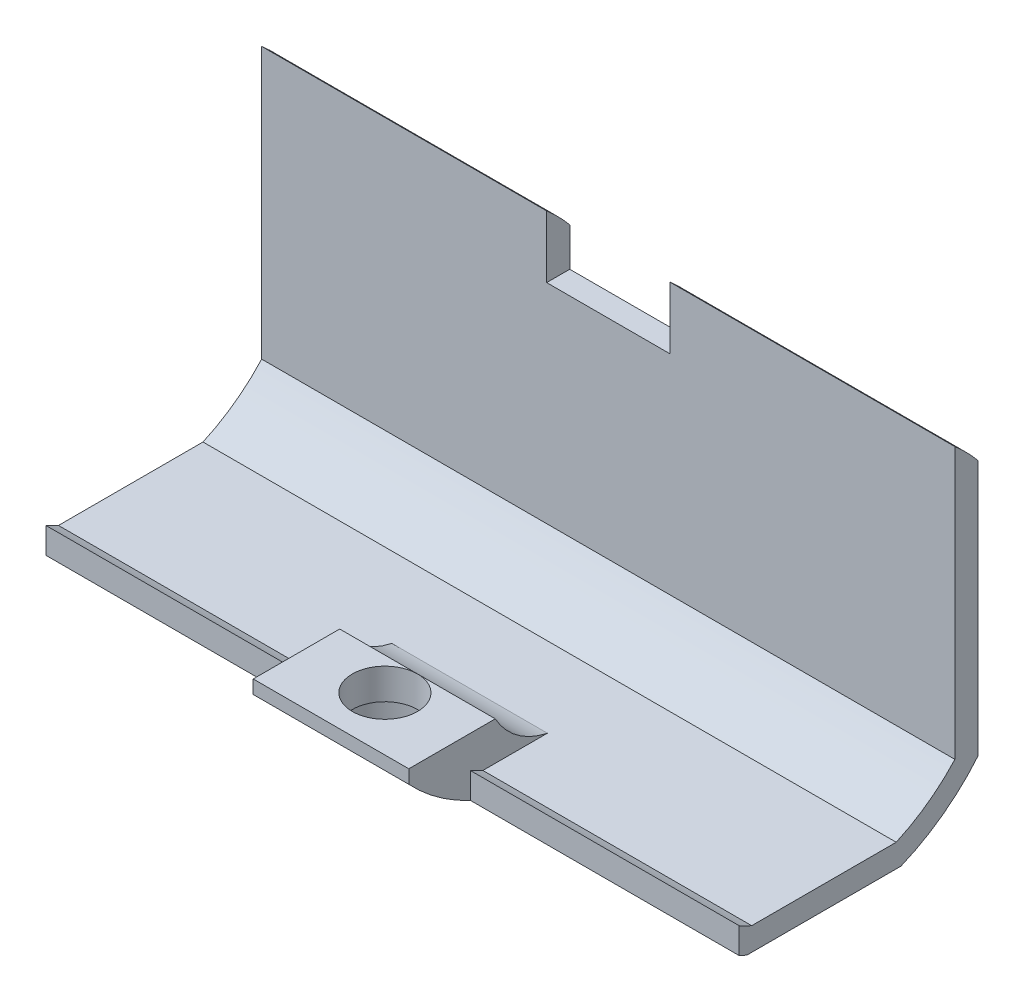
from build123d import *

# Parameters (mm, degrees)
MODEL_R                   = 8.35
RESSALTO_EXTRUS_O2_DEPTH  = 4
ESBO_O5_W                 = 2
ESBO_O5_H                 = 24
RESSALTO_EXTRUS_O3_DEPTH  = 20
ESBO_O6_OUTSIDE_W         = 30.002
ESBO_O6_OUTSIDE_H         = 34.002
ESBO_O6_OUTSIDE_R         = 13
CORTE_EXTRUS_O1_DEPTH     = 72.292987034
CORTE_EXTRUS_O2_DEPTH     = 72.292987124
RESSALTO_EXTRUS_O4_DEPTH  = 4
CORTE_EXTRUS_O3_DEPTH     = 38.486664414
RESSALTO_EXTRUS_O5_START  = 0.5
RESSALTO_EXTRUS_O5_DEPTH  = 45
RESSALTO_EXTRUS_O6_START  = 0.5
ESBO_O14_R                = 2.115
RESSALTO_EXTRUS_O6_DEPTH  = 3.779219
CORTE_EXTRUS_O4_DEPTH     = 10.1
CORTE_EXTRUS_O7_DEPTH     = 10
ESBO_O17_R                = 3.5
CORTE_EXTRUS_O8_DEPTH     = 2
CORTE_EXTRUS_O11_REACH    = 75.217
ESBO_O19_W                = 67.006666236
ESBO_O19_H                = 28.204946311
CORTE_EXTRUS_O9_DEPTH     = 52.948283002
CORPO_MOVER_COPIAR2_ANGLE = 180


with BuildPart() as part:
    # Model → Ressalto-extrusão2 (new body)
    with BuildSketch(Plane.XY):
        Polygon((0, 44.200000002), (0, 59.200000002), (-5.55, 59.200000002), (-5.55, 63.700000002), (-23, 63.700000002), (-23, 39.700000002), (-5.55, 39.700000002), (-5.55, 44.200000002), align=None)
        with Locations((-13.5, 51.700000002)):
            Circle(MODEL_R, mode=Mode.SUBTRACT)
    extrude(amount=RESSALTO_EXTRUS_O2_DEPTH)

    # Esboço5 → Ressalto-extrusão3 (add)
    with BuildSketch(Plane(origin=(0, 0, 0), x_dir=(-1, 0, 0), z_dir=(0, 0, -1))):
        with Locations((24, 51.700000002)):
            Rectangle(ESBO_O5_W, ESBO_O5_H)
    extrude(amount=-RESSALTO_EXTRUS_O3_DEPTH)

    # Esboço6 outside → Corte-extrusão1 (cut, through all)
    with BuildSketch(Plane.ZY.offset(25)):
        with Locations((10, 51.7)):
            Rectangle(ESBO_O6_OUTSIDE_W, ESBO_O6_OUTSIDE_H)
        with Locations((10, 51.700000002)):
            Circle(ESBO_O6_OUTSIDE_R, mode=Mode.SUBTRACT)
    extrude(amount=-CORTE_EXTRUS_O1_DEPTH, mode=Mode.SUBTRACT)

    # Esboço8 → Corte-extrusão2 (cut, through all)
    with BuildSketch(Plane.ZY.offset(25)):
        Polygon((7.885, 51.700000002), (10, 49.585000002), (12.115, 51.700000002), (10, 53.815000002), align=None)
    extrude(amount=-CORTE_EXTRUS_O2_DEPTH, mode=Mode.SUBTRACT)

    # Espelhar1: part across plane


with BuildPart() as part_1:
    add(part.part)
    add(part.part.mirror(Plane(origin=(0, 44.200000002, 4), x_dir=(0, 0, 1), z_dir=(-1, 0, 0))))

    # Esboço9 → Ressalto-extrusão4 (add)
    with BuildSketch(Plane.XY.offset(4)):
        Polygon((0, 59.200000002), (4, 59.200000002), (4, 44.200000002), (-4, 44.200000002), (-4, 59.200000002), align=None)
    extrude(amount=RESSALTO_EXTRUS_O4_DEPTH)

    # Esboço10 → Corte-extrusão3 (cut, through all)
    with BuildSketch(Plane(origin=(0, 59.200000002, 0), x_dir=(1, 0, 0), z_dir=(0, 1, 0))):
        Polygon((0, -1.885), (-2.115, -4), (0, -6.115), (2.115, -4), align=None)
    extrude(amount=-CORTE_EXTRUS_O3_DEPTH, mode=Mode.SUBTRACT)


with BuildPart() as body_2:
    # Esboço13 → Ressalto-extrusão5 (new body)
    with BuildSketch(Plane.ZY.offset(-23).offset(RESSALTO_EXTRUS_O5_START)):
        with BuildLine():
            Line((18.5, 43.95403331), (18.5, 59.445966694))
            ThreePointArc((18.5, 59.445966694), (16.73742843, 61.019713418), (14.69041576, 62.200000002))
            Line((14.69041576, 62.200000002), (5.30958424, 62.200000002))
            ThreePointArc((5.30958424, 62.200000002), (4.900858659, 62.0077038), (4.5, 61.79950494))
            Line((4.5, 61.79950494), (4.5, 63.479218991))
            ThreePointArc((4.5, 63.479218991), (4.748839551, 63.592237552), (5, 63.700000002))
            Line((5, 63.700000002), (15, 63.700000002))
            ThreePointArc((15, 63.700000002), (17.724005232, 62.156564599), (20, 60.006623865))
            Line((20, 60.006623865), (20, 43.393376139))
            ThreePointArc((20, 43.393376139), (19.281560672, 42.597657914), (18.5, 41.863842216))
            Line((18.5, 41.863842216), (18.5, 43.95403331))
        make_face()
    extrude(amount=RESSALTO_EXTRUS_O5_DEPTH)

    # Esboço14 → Ressalto-extrusão6 (add)
    with BuildSketch(Plane(origin=(0, 59.200000002, 0), x_dir=(1, 0, 0), z_dir=(0, 1, 0)).offset(RESSALTO_EXTRUS_O6_START)):
        Polygon((5.05, -4), (5.05, -8), (5.05, -9.5), (-5.05, -9.5), (-5.05, -8), (-5.05, -4), (-5.05, -0.5), (5.05, -0.5), align=None)
        with Locations(Location((0, -4, 0), (0, 0, 346.325447319))):
            Circle(ESBO_O14_R, mode=Mode.SUBTRACT)
    extrude(amount=RESSALTO_EXTRUS_O6_DEPTH)

    # Esboço15 → Corte-extrusão4 (cut)
    with BuildSketch(Plane(origin=(5.05, 0, 0), x_dir=(0, 0, -1), z_dir=(1, 0, 0))):
        with BuildLine():
            Line((-5.561651151, 63.918881272), (-4.5, 63.918881272))
            Line((-4.5, 63.918881272), (-4.5, 64.979109715))
            Line((-4.5, 64.979109715), (0, 64.979109715))
            Line((0, 64.979109715), (0, 60.006623865))
            ThreePointArc((0, 60.006623865), (-2.520500092, 62.332830346), (-5.561651151, 63.918881272))
        make_face()
    extrude(amount=-CORTE_EXTRUS_O4_DEPTH, mode=Mode.SUBTRACT)

    # Esboço18 → Corte-extrusão7 (cut)
    with BuildSketch(Plane.XY.offset(20)):
        Polygon((-4, 45.893376139), (0, 45.893376139), (4, 45.893376139), (4, 37.813192245), (-4, 37.813192245), align=None)
    extrude(amount=-CORTE_EXTRUS_O7_DEPTH, mode=Mode.SUBTRACT)

    # Esboço17 → Corte-extrusão8 (cut)
    with BuildSketch(Plane(origin=(0, 63.700000002, 0), x_dir=(1, 0, 0), z_dir=(0, 1, 0))):
        with Locations((0, -4)):
            Circle(ESBO_O17_R)
    extrude(amount=-CORTE_EXTRUS_O8_DEPTH, mode=Mode.SUBTRACT)

    # Corte-extrusão11: up to this face of the body (flat: up to its plane)
    corte_extrus_o11_end = Plane(body_2.part.faces().sort_by_distance((-5.05, 61.009194207, 5.162360776))[0])
    # Esboço21 → Corte-extrusão11 (cut, up to the picked face)
    with BuildSketch(Plane(origin=(5.05, 0, 0), x_dir=(0, 0, -1), z_dir=(1, 0, 0)), mode=Mode.PRIVATE) as corte_extrus_o11_sk1:
        with BuildLine():
            Line((-6.115, 59.700000002), (-9.5, 59.700000002))
            Line((-9.5, 59.700000002), (-9.5, 62.200000002))
            ThreePointArc((-9.5, 62.200000002), (-7.531688037, 61.3234494), (-6.115, 59.700000002))
        make_face()
    corte_extrus_o11_tool1 = split(extrude(corte_extrus_o11_sk1.sketch, amount=-CORTE_EXTRUS_O11_REACH, mode=Mode.PRIVATE), bisect_by=corte_extrus_o11_end, keep=Keep.BOTH, mode=Mode.PRIVATE)
    add(corte_extrus_o11_tool1.solids().sort_by(Axis((5.05, 60.667689, 8.211637), (-1, 0, 0)))[0], mode=Mode.SUBTRACT)


with BuildPart() as part_2:
    # Corpo-Mover/Copiar1: moved
    add(part_1.part.moved(Location((0, 0, -38.699148431))))

    # Esboço19 → Corte-extrusão9 (cut, through all)
    with BuildSketch(Plane(origin=(0, 63.700000002, 0), x_dir=(1, 0, 0), z_dir=(0, 1, 0))):
        with Locations((-0.756912401, 28.10560681)):
            Rectangle(ESBO_O19_W, ESBO_O19_H)
    extrude(amount=-CORTE_EXTRUS_O9_DEPTH, mode=Mode.SUBTRACT)


with BuildPart() as body_2_1:
    # Corpo-Mover/Copiar2: moved
    add(body_2.part.rotate(Axis((0, 0, 0), (1, 0, 0)), CORPO_MOVER_COPIAR2_ANGLE))


solid = body_2_1.part
